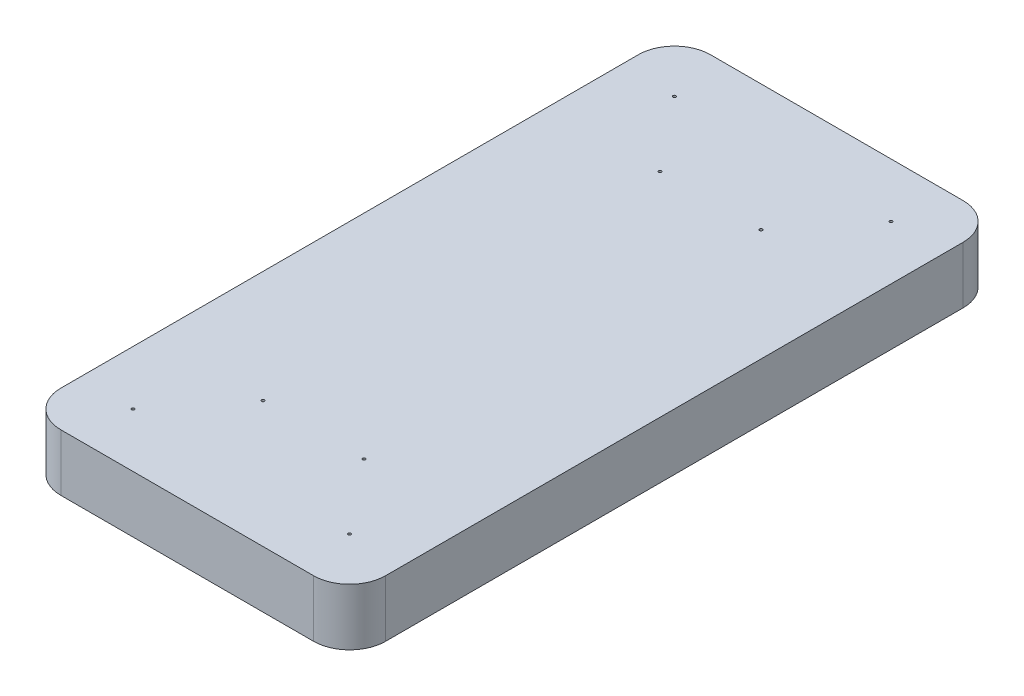
from build123d import *

# Parameters (mm, degrees)
SKETCH1_W           = 114.3
SKETCH1_H           = 228.6
BOSS_EXTRUDE2_DEPTH = 20
SKETCH5_R           = 0.5
CUT_EXTRUDE1_DEPTH  = 257.363901515
SKETCH6_R           = 0.5
CUT_EXTRUDE2_DEPTH  = 257.363901515
FILLET1_R           = 12.7


with BuildPart() as part:
    # Sketch1 → Boss-Extrude2 (new body)
    with BuildSketch(Plane(origin=(0, 0, 0), x_dir=(1, 0, 0), z_dir=(0, 1, 0))):
        with Locations((57.15, 114.3)):
            Rectangle(SKETCH1_W, SKETCH1_H)
    extrude(amount=BOSS_EXTRUDE2_DEPTH)

    # Sketch5 → Cut-Extrude1 (cut, through all)
    with BuildSketch(Plane(origin=(0, 20, 0), x_dir=(1, 0, 0), z_dir=(0, 1, 0))):
        with Locations((19.05, 209.55)):
            Circle(SKETCH5_R)
        with Locations((19.05, 19.05)):
            Circle(SKETCH5_R)
        with Locations((95.25, 209.55)):
            Circle(SKETCH5_R)
        with Locations((95.25, 19.05)):
            Circle(SKETCH5_R)
    extrude(amount=-CUT_EXTRUDE1_DEPTH, mode=Mode.SUBTRACT)

    # Sketch6 → Cut-Extrude2 (cut, through all)
    with BuildSketch(Plane.XZ):
        with Locations((39.37, -184.15)):
            Circle(SKETCH6_R)
        with Locations((74.93, -184.15)):
            Circle(SKETCH6_R)
        with Locations((39.37, -44.45)):
            Circle(SKETCH6_R)
        with Locations((74.93, -44.45)):
            Circle(SKETCH6_R)
    extrude(amount=-CUT_EXTRUDE2_DEPTH, mode=Mode.SUBTRACT)

    # Fillet1
    fillet1_edges = [part.edges().sort_by_distance(p)[0] for p in [
        (0, 10, -228.6),
        (114.3, 10, 0),
        (0, 10, 0),
        (114.3, 10, -228.6),
    ]]
    fillet(fillet1_edges, radius=FILLET1_R)


solid = part.part
